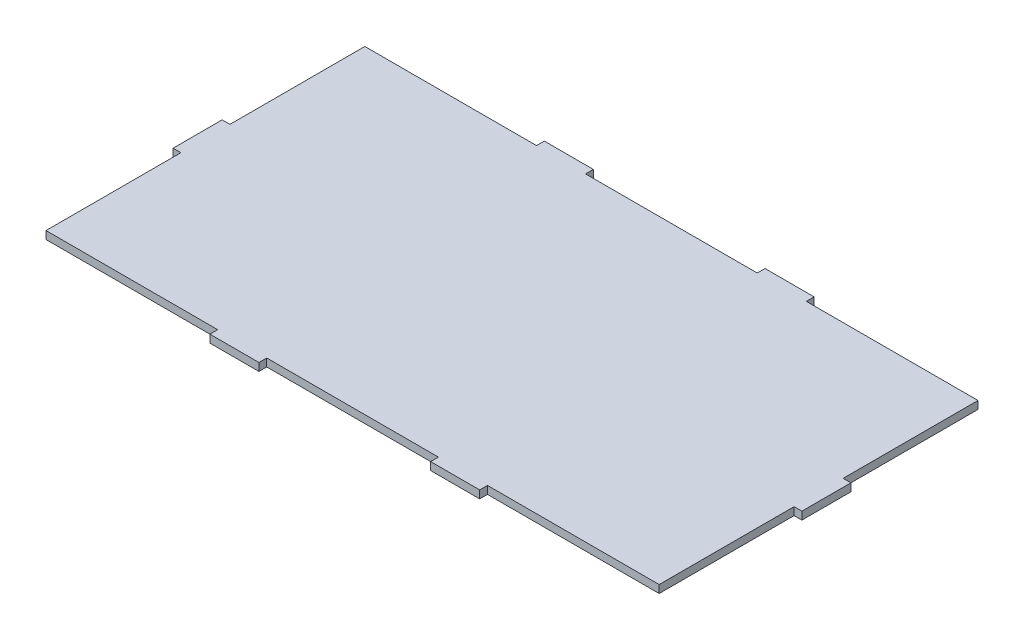
from build123d import *

# Parameters (mm, degrees)
ESQUISSE1_W        = 250
ESQUISSE1_H        = 130
BOSS_EXTRU_1_DEPTH = 3.175
ESQUISSE2_W        = 3.175
ESQUISSE2_H        = 20
ESQUISSE2_W_2      = 20
ESQUISSE2_H_2      = 3.175
BOSS_EXTRU_2_DEPTH = 3.175


with BuildPart() as part:
    # Esquisse1 → Boss.-Extru.1 (new body)
    with BuildSketch(Plane(origin=(0, 0, 0), x_dir=(1, 0, 0), z_dir=(0, 1, 0))):
        with Locations((125, 65)):
            Rectangle(ESQUISSE1_W, ESQUISSE1_H)
    extrude(amount=BOSS_EXTRU_1_DEPTH)

    # Esquisse2 → Boss.-Extru.2 (add)
    with BuildSketch(Plane(origin=(0, 3.175, 0), x_dir=(1, 0, 0), z_dir=(0, 1, 0))):
        with Locations((-1.5875, 65)):
            Rectangle(ESQUISSE2_W, ESQUISSE2_H)
        with Locations((251.5875, 65)):
            Rectangle(ESQUISSE2_W, ESQUISSE2_H)
        with Locations((80, 131.5875)):
            Rectangle(ESQUISSE2_W_2, ESQUISSE2_H_2)
        with Locations((170, 131.5875)):
            Rectangle(ESQUISSE2_W_2, ESQUISSE2_H_2)
        with Locations((170, -1.5875)):
            Rectangle(ESQUISSE2_W_2, ESQUISSE2_H_2)
        with Locations((80, -1.5875)):
            Rectangle(ESQUISSE2_W_2, ESQUISSE2_H_2)
    extrude(amount=-BOSS_EXTRU_2_DEPTH)


solid = part.part
